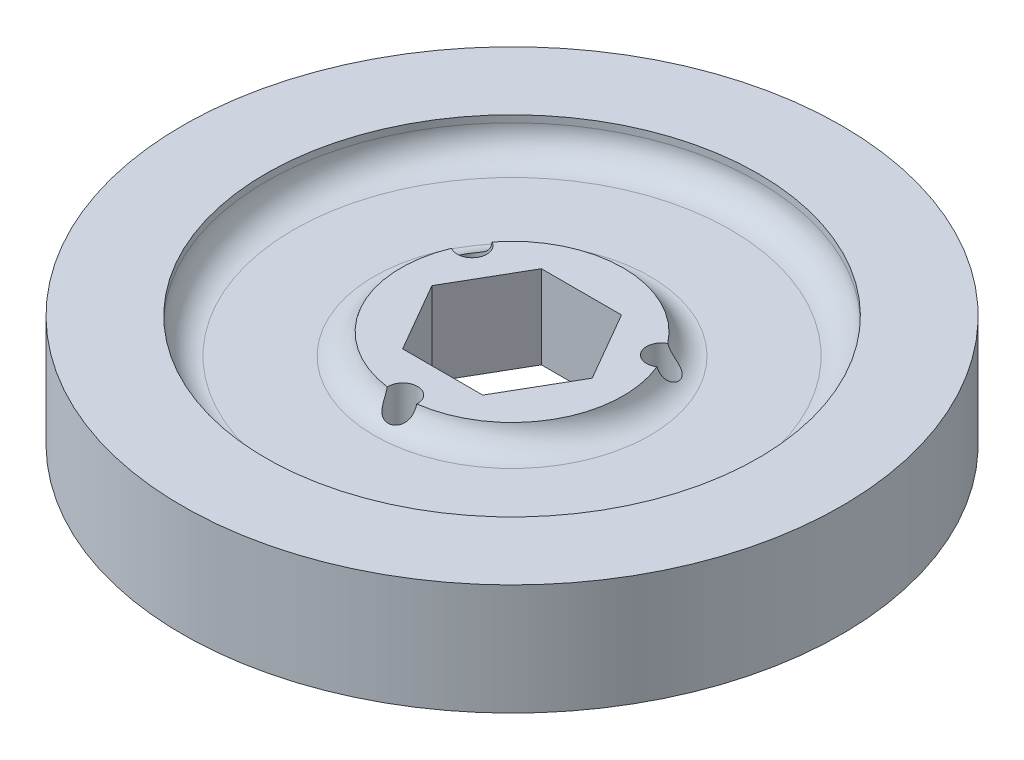
from build123d import *

# Parameters (mm, degrees)
FILLET1_R             = 2.54
FILLET2_R             = 2.54
CUT_EXTRUDE1_DEPTH    = 44.572754245
F_6_32_TAPPED_HOLE1_D = 2.7051


with BuildPart() as part:
    # Sketch1 → Revolve1 (revolve)
    with BuildSketch(Plane.XY, mode=Mode.PRIVATE) as revolve1_sk:
        Polygon((10.16, -1.905), (10.16, -3.81), (0, -3.81), (0, 3.81), (10.16, 3.81), (10.16, 1.905), (22.5425, 1.905), (22.5425, 5.08), (30.1625, 5.08), (30.1625, -5.08), (22.5425, -5.08), (22.5425, -1.905), align=None)
    revolve(revolve1_sk.sketch.rotate(Axis((0, 0, 0), (0, 1, 0)), 90), axis=Axis((0, 0, 0), (0, 1, 0)))

    # Fillet1
    # the kernel refuses this fillet: 2.54 mm, written as the material it adds along each edge
    with BuildSketch(Plane(origin=(0, 1.905, 0), x_dir=(0, 0, -1), z_dir=(1, 0, 0))) as fillet1_piece_1:
        with BuildLine():
            CenterArc((12.619344425, 2.54), FILLET1_R, 194.477512186, 75.522487814)
            Line((12.619344425, 0), (12.619344425, -0.0508))
            Line((12.619344425, -0.0508), (10.16, -0.0508))
            Line((10.16, -0.0508), (10.1092, 0))
            ThreePointArc((10.1092, 0), (10.1092, 0.9525), (10.110813112, 1.8923))
            Line((10.110813112, 1.8923), (10.16, 1.905))
        make_face()
    revolve(axis=Axis((0, 1.905, 0), (0, 1, 0)))
    with BuildSketch(Plane(origin=(0, 1.905, 0), x_dir=(0, 0, -1), z_dir=(1, 0, 0))) as fillet1_piece_2:
        with BuildLine():
            CenterArc((22.5425 - FILLET1_R, FILLET1_R), FILLET1_R, 270, 90)
            Line((22.5425, FILLET1_R), (22.5425 + FILLET1_R * 0.02, FILLET1_R))
            Line((22.5425 + FILLET1_R * 0.02, FILLET1_R), (22.5425 + FILLET1_R * 0.02, -FILLET1_R * 0.02))
            Line((22.5425 + FILLET1_R * 0.02, -FILLET1_R * 0.02), (22.5425 - FILLET1_R, -FILLET1_R * 0.02))
            Line((22.5425 - FILLET1_R, -FILLET1_R * 0.02), (22.5425 - FILLET1_R, 0))
        make_face()
    revolve(axis=Axis((0, 1.905, 0), (0, 1, 0)))

    # Fillet2
    # the kernel refuses this fillet: 2.54 mm, written as the material it adds along each edge
    with BuildSketch(Plane(origin=(0, -1.905, 0), x_dir=(0, 0, -1), z_dir=(1, 0, 0))) as fillet2_piece_1:
        with BuildLine():
            CenterArc((22.5425 - FILLET2_R, -FILLET2_R), FILLET2_R, 0, 90)
            Line((22.5425 - FILLET2_R, 0), (22.5425 - FILLET2_R, FILLET2_R * 0.02))
            Line((22.5425 - FILLET2_R, FILLET2_R * 0.02), (22.5425 + FILLET2_R * 0.02, FILLET2_R * 0.02))
            Line((22.5425 + FILLET2_R * 0.02, FILLET2_R * 0.02), (22.5425 + FILLET2_R * 0.02, -FILLET2_R))
            Line((22.5425 + FILLET2_R * 0.02, -FILLET2_R), (22.5425, -FILLET2_R))
        make_face()
    revolve(axis=Axis((0, -1.905, 0), (0, 1, 0)))
    with BuildSketch(Plane(origin=(0, -1.905, 0), x_dir=(0, 0, -1), z_dir=(1, 0, 0))) as fillet2_piece_2:
        with BuildLine():
            CenterArc((12.619344425, -2.54), FILLET2_R, 90, 75.522487814)
            Line((10.16, -1.905), (10.110813112, -1.8923))
            ThreePointArc((10.110813112, -1.8923), (10.1092, -0.9525), (10.1092, 0))
            Line((10.1092, 0), (10.16, 0.0508))
            Line((10.16, 0.0508), (12.619344425, 0.0508))
            Line((12.619344425, 0.0508), (12.619344425, 0))
        make_face()
    revolve(axis=Axis((0, -1.905, 0), (0, 1, 0)))

    # Sketch2 → Cut-Extrude1 (cut, through all)
    with BuildSketch(Plane.XZ.offset(3.81)):
        Polygon((3.666174209, 6.35), (-3.666174209, 6.35), (-7.332348419, 0), (-3.666174209, -6.35), (3.666174209, -6.35), (7.332348419, 0), align=None)
    extrude(amount=-CUT_EXTRUDE1_DEPTH, mode=Mode.SUBTRACT)

    # #6-32 Tapped Hole1 (through all)
    with Locations(Plane(origin=(0, 3.81, 0), x_dir=(1, 0, 0), z_dir=(0, 1, 0))):
        with Locations((0, -10), (-8.660254038, 5), (8.660254038, 5)):
            Hole(F_6_32_TAPPED_HOLE1_D / 2)


solid = part.part
